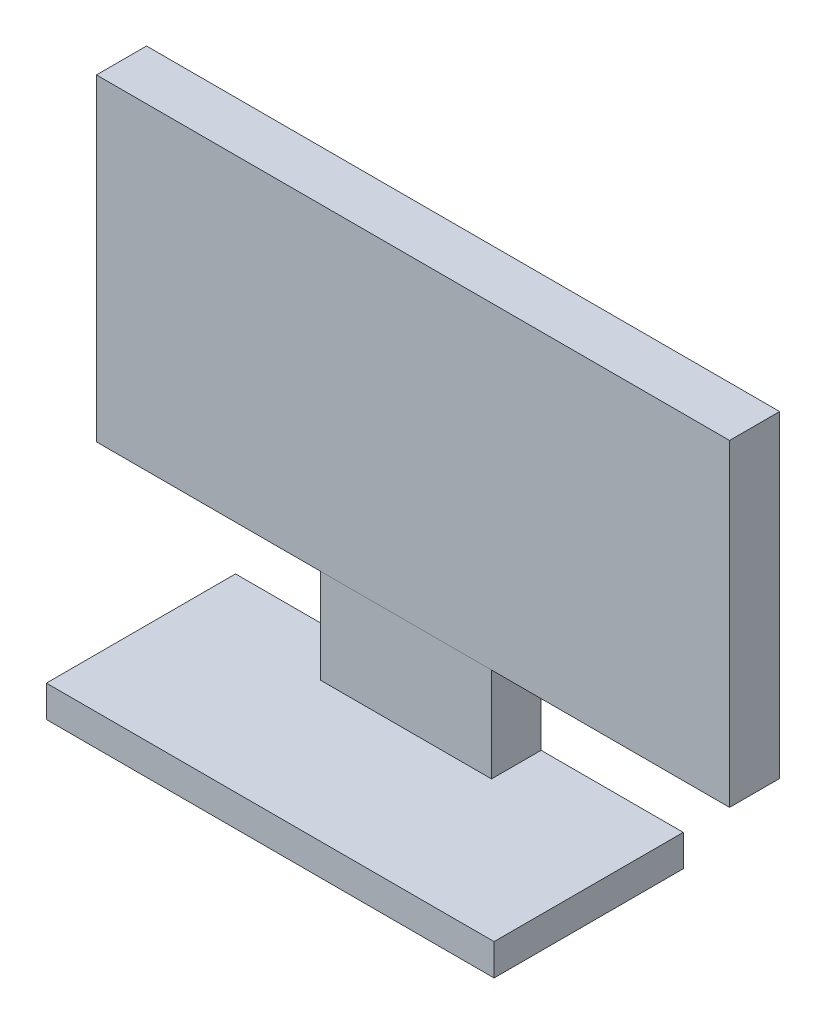
from build123d import *

# Parameters (mm, degrees)
SKETCH1_W           = 35.5
SKETCH1_H           = 15
BOSS_EXTRUDE7_DEPTH = 2.5
SKETCH5_W           = 13.567085075
SKETCH5_H           = 3.932792286
BOSS_EXTRUDE8_DEPTH = 7.5
SKETCH6_W           = 50.2
SKETCH6_H           = 3.97
BOSS_EXTRUDE9_DEPTH = 25.2


with BuildPart() as part:
    # Sketch1 → Boss-Extrude7 (new body)
    with BuildSketch(Plane(origin=(0, 0, 0), x_dir=(1, 0, 0), z_dir=(0, 1, 0))):
        with Locations((32.254129859, 13.775388257)):
            Rectangle(SKETCH1_W, SKETCH1_H)
    extrude(amount=BOSS_EXTRUDE7_DEPTH)

    # Sketch5 → Boss-Extrude8 (add)
    with BuildSketch(Plane(origin=(0, 2.5, 0), x_dir=(1, 0, 0), z_dir=(0, 1, 0))):
        with Locations((31.950040022, 19.308992114)):
            Rectangle(SKETCH5_W, SKETCH5_H)
    extrude(amount=BOSS_EXTRUDE8_DEPTH)

    # Sketch6 → Boss-Extrude9 (add)
    with BuildSketch(Plane(origin=(1.124638213, 10, 0), x_dir=(1, 0, 0), z_dir=(0, 1, 0))):
        with Locations((31.402213384, 19.309771585)):
            Rectangle(SKETCH6_W, SKETCH6_H)
    extrude(amount=BOSS_EXTRUDE9_DEPTH)


solid = part.part
